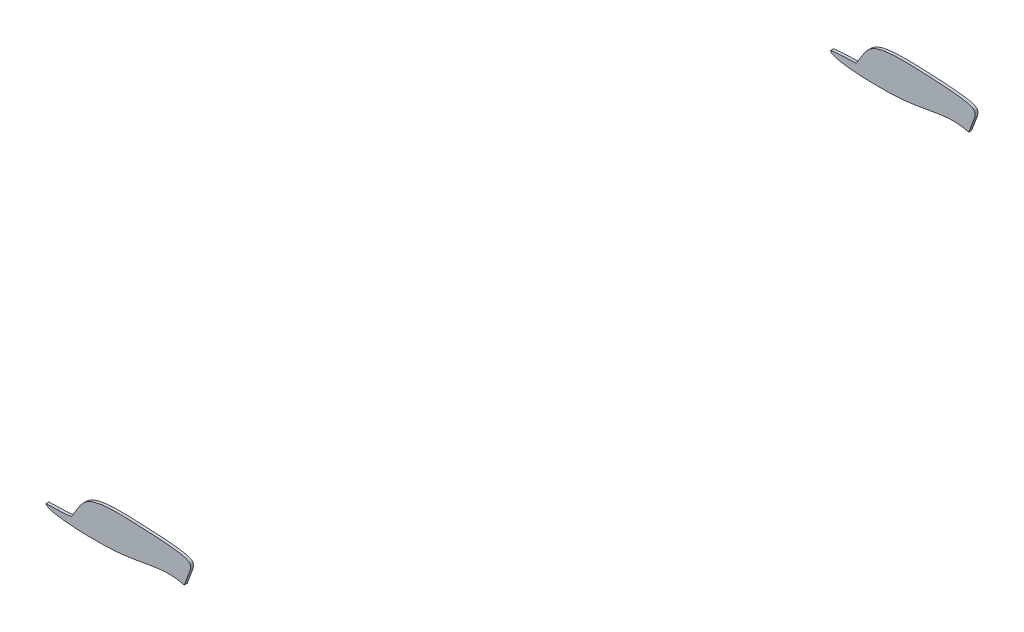
from build123d import *

# Parameters (mm, degrees)
BOSS_EXTRUDE1_START = -100
BOSS_EXTRUDE1_DEPTH = 100
BOSS_EXTRUDE2_DEPTH = 100


# Read off the part's stored shape, not the designer's step: Boss-Extrude1
with BuildPart() as part:
    # Boss-Extrude1 outline → Boss-Extrude1 (new body)
    with BuildSketch(Plane.XY.offset(14000).offset(BOSS_EXTRUDE1_START)):
        with BuildLine():
            add(Edge.make_bspline(
                [(5531.048982521, 503.061584124), (5984.616082643, 1919.72784269), (6610.819234991, 1057.300960896), (1608.535097677, 1775.314775895), (2314.83364403, 1835.642488739), (1522.852619017, 616.42771481)],
                knots=[0, 0, 0, 0, 0, 0, 1, 1, 1, 1, 1, 1], degree=5))
            add(Edge.make_bspline(
                [(1522.852619017, 616.42771481), (1504.861181316, 559.60506265), (607.536000606, 547.11334457)],
                knots=[0, 0, 0, 1, 1, 1], degree=2))
            add(Edge.make_bspline(
                [(607.536000606, 547.11334457), (608.61547062, 544.033573702), (611.045347663, 537.968945908), (615.483416305, 529.231580539), (620.657786063, 520.910020616), (626.516602345, 513.055207557), (633.000410712, 505.709814659), (639.985420636, 498.842386331), (647.372592677, 492.411753686), (655.068858247, 486.356335059), (663.024312246, 480.646271644), (671.208906672, 475.270208171), (679.588971837, 470.205290463), (690.988425826, 463.840742219), (705.593427952, 456.550096934), (720.539245681, 449.992870153), (732.640301911, 445.096298549), (741.775254544, 441.573611419), (750.956775868, 438.174518939), (760.17671752, 434.88117582), (769.43737021, 431.703719723), (781.838637045, 427.627689694), (797.443068213, 422.851224267), (813.182218698, 418.54076935), (825.823314703, 415.28479904), (835.323121286, 412.916701836), (844.83562701, 410.601086405), (854.355012195, 408.31360718), (863.881907073, 406.057615027), (876.597565949, 403.105824911), (892.519723231, 399.535371849), (911.684221454, 395.517562006), (930.893353507, 391.720269357), (950.130009956, 388.065451499), (969.386896788, 384.5189289), (988.67021316, 381.118206113), (1007.984616594, 377.898879135), (1027.323158164, 374.828500894), (1046.674474761, 371.840251494), (1066.032633628, 368.896585524), (1085.400455087, 366.017052029), (1104.779922418, 363.216939998), (1124.17103078, 360.498585293), (1143.572627524, 357.85624672), (1162.98408502, 355.287244255), (1188.879066439, 351.962070539), (1221.27144442, 347.992324644), (1253.694853147, 344.284620877), (1279.650164831, 341.468786558), (1299.123659905, 339.422633415), (1318.604945661, 337.451782033), (1338.096250077, 335.582262763), (1354.34743157, 334.115199067), (1367.350183883, 332.96210047), (1380.35280587, 331.80759849), (1396.603335737, 330.333517883), (1416.101093714, 328.53368124), (1435.606101938, 326.812513824), (1451.870613039, 325.500988711), (1464.88433906, 324.479230733), (1474.644813184, 323.71523721), (1484.404587951, 322.94216255), (1497.415635354, 321.886638389), (1513.678087803, 320.551060561), (1533.198518249, 319.014763984), (1552.730231069, 317.62942423), (1569.010004189, 316.524874861), (1582.033023329, 315.629011975), (1595.054488748, 314.71101956), (1611.330116555, 313.546728481), (1630.863846699, 312.190925146), (1650.40499827, 310.946230156), (1669.952298429, 309.802443077), (1689.505176617, 308.75845179), (1709.061792936, 307.787853934), (1728.61969466, 306.84382394), (1748.176803297, 305.88342049), (1767.732939289, 304.903427735), (1787.287317514, 303.888737969), (1806.841472739, 302.870437445), (1826.399598884, 301.928521883), (1845.963978582, 301.127820717), (1862.269438019, 300.508624137), (1875.313266654, 299.998731234), (1888.356157971, 299.465418782), (1904.65898391, 298.780422978), (1924.224800231, 298.015468656), (1943.795630348, 297.391203709), (1963.368633052, 296.843677412), (1982.941685065, 296.29698828), (2002.513713366, 295.715113461), (2022.084984445, 295.108136884), (2041.655275855, 294.470647575), (2057.964926644, 293.972471311), (2071.014155227, 293.626953252), (2084.064566948, 293.329081014), (2100.37886752, 293.019616664), (2119.956329983, 292.664396289), (2136.269723154, 292.309407413), (2149.320526825, 292.031041011), (2159.108939004, 291.836426272), (2168.897798293, 291.66587555), (2181.950373155, 291.486248718), (2198.26687855, 291.329884927), (2217.8470089, 291.184094373), (2237.426904577, 291.008768802), (2257.006547852, 290.807597963), (2276.585856414, 290.575705883), (2296.165125149, 290.342054673), (2315.745191108, 290.176957564), (2335.325914448, 290.139527376), (2354.906551987, 290.175168405), (2374.487193904, 290.213456844), (2394.067870789, 290.219987369), (2413.648543328, 290.201800561), (2433.229151737, 290.151521946), (2449.546403949, 290.14100305), (2462.600132083, 290.185221882), (2475.653616877, 290.277620966), (2491.969863794, 290.45722968), (2511.549174815, 290.689829761), (2527.865887706, 290.821524602), (2540.919201941, 290.933090428), (2550.709037068, 291.031512036), (2560.498599137, 291.156323148), (2573.550589518, 291.374545737), (2589.864222862, 291.717682451), (2609.440136227, 292.150198439), (2625.754700423, 292.446135862), (2638.806253516, 292.687788485), (2648.594628936, 292.883370561), (2658.38247469, 293.105186511), (2671.431659214, 293.452772205), (2687.741067154, 293.95849614), (2707.311657397, 294.58709778), (2723.622413007, 295.047799609), (2736.67089337, 295.419401425), (2746.45683921, 295.712991861), (2756.242016365, 296.031018149), (2769.287180188, 296.506337268), (2785.590855824, 297.171616757), (2805.154101198, 297.997882877), (2824.71989585, 298.761492393), (2844.285860835, 299.520343852), (2863.848824804, 300.354579472), (2883.406705271, 301.300747799), (2902.959301598, 302.350260883), (2922.50598772, 303.50436754), (2942.049631218, 304.707891129), (2961.595039944, 305.882807452), (2981.142707939, 307.019196803), (3000.687635571, 308.202637868), (3020.225661534, 309.49562388), (3039.756807498, 310.887944222), (3059.28318655, 312.345539503), (3078.804587053, 313.868199369), (3098.318759061, 315.481844866), (3117.822543102, 317.21606208), (3134.071645557, 318.705524121), (3147.07199615, 319.885422701), (3160.074404694, 321.04260139), (3176.329271368, 322.467435071), (3192.580240036, 323.937531583), (3205.573604516, 325.192108736), (3215.315790987, 326.162218516), (3225.056008905, 327.151432155), (3234.796171581, 328.141411302), (3244.53717325, 329.123094256), (3254.280837799, 330.077949946), (3264.026051076, 331.017022606), (3277.01868606, 332.278641834), (3290.006739177, 333.588629717), (3302.980704314, 335.031089145), (3312.704166049, 336.173602569), (3322.423153916, 337.353545598), (3332.139758646, 338.552835581), (3341.856085013, 339.754383361), (3351.575085126, 340.934216659), (3361.29629059, 342.095568876), (3374.259141588, 343.633688227), (3390.461855869, 345.563726591), (3409.892142026, 347.986574856), (3429.308371794, 350.519515043), (3448.711673065, 353.149472407), (3468.104020255, 355.858864302), (3487.491391623, 358.603405658), (3506.880201391, 361.337827864), (3526.271689869, 364.053170713), (3545.66594066, 366.748735182), (3565.061946358, 369.431575423), (3584.453005196, 372.150202899), (3603.832089653, 374.953067351), (3623.197069227, 377.85186739), (3642.547786074, 380.844310475), (3661.884750401, 383.924268366), (3681.214768136, 387.047259046), (3700.54544639, 390.166223553), (3719.879472228, 393.264342472), (3739.217404669, 396.338045035), (3758.559030951, 399.388278798), (3777.894903953, 402.475166967), (3797.212840239, 405.672622357), (3816.513495944, 408.972461893), (3835.8105353, 412.293129166), (3855.113368098, 415.580082439), (3874.419039907, 418.850209506), (3893.72276753, 422.131854963), (3913.024553094, 425.424848038), (3932.329058166, 428.701959751), (3951.639273707, 431.945114623), (3970.946564172, 435.205924744), (3990.236223479, 438.569786422), (4009.506067572, 442.045122111), (4028.769515514, 445.555383558), (4048.038090444, 449.037551001), (4067.31084157, 452.496431034), (4086.583118015, 455.957985356), (4105.853563621, 459.429703243), (4125.124135337, 462.900725798), (4144.396546268, 466.361525475), (4163.669061185, 469.821735181), (4182.937037345, 473.307201343), (4202.200648755, 476.816573218), (4221.471979804, 480.283718859), (4240.763637768, 483.636065575), (4260.071165826, 486.89539909), (4279.382068958, 490.134492439), (4298.688394259, 493.400851865), (4317.990754787, 496.690516203), (4337.28744469, 500.013331686), (4356.585145913, 503.330151005), (4375.896824796, 506.565347931), (4392.008118513, 509.149974112), (4404.900764264, 511.194689047), (4414.570463138, 512.726854296), (4424.238785744, 514.267770646), (4437.125976763, 516.346684825), (4453.232618521, 518.959611483), (4472.571337391, 522.029057108), (4488.706933543, 524.45768327), (4501.619210743, 526.374349669), (4511.303593412, 527.810894971), (4520.986221455, 529.259193778), (4530.665132197, 530.732064072), (4540.342696137, 532.213947184), (4553.247801306, 534.178158675), (4569.388680039, 536.572297733), (4588.791673589, 539.206739788), (4608.216570692, 541.672220563), (4627.651072185, 544.060556001), (4647.08965418, 546.415232284), (4666.534777645, 548.715536053), (4685.986630841, 550.95811914), (4705.449903688, 553.100220376), (4724.929497464, 555.089082876), (4744.426489939, 556.899743534), (4763.937702714, 558.549243866), (4783.461264209, 560.045925015), (4802.995641445, 561.393402704), (4822.539449616, 562.597067692), (4842.091968729, 563.649302095), (4861.653313282, 564.52565218), (4877.96116867, 565.083894609), (4891.009381962, 565.464953459), (4900.796064481, 565.732798346), (4910.583012007, 565.990695672), (4920.369768813, 566.255027034), (4930.156724045, 566.513695181), (4943.206863096, 566.819984384), (4956.259260201, 567.034127934), (4969.313176804, 567.069570609), (4982.366854311, 566.997249821), (4995.419449506, 566.813605057), (5008.471450776, 566.59900517), (5018.260612954, 566.447548259), (5028.049860984, 566.299275075), (5041.101660378, 566.075370308), (5057.415225205, 565.713528341), (5076.982990205, 564.986852625), (5096.537965538, 563.97421434), (5116.077307041, 562.696390887), (5135.599894905, 561.185558875), (5155.108745109, 559.508841539), (5174.608770126, 557.732881317), (5194.094681986, 555.805775495), (5213.553787347, 553.622500157), (5232.97889468, 551.155583017), (5249.145925444, 548.946400038), (5262.072784413, 547.130316334), (5274.994236221, 545.276167348), (5291.134231174, 542.876657958), (5310.468899127, 539.779891921), (5329.760330162, 536.424183936), (5349.00943791, 532.834376939), (5368.216987628, 529.028350803), (5387.381953507, 525.013752105), (5406.503371483, 520.796327248), (5425.578403808, 516.374125192), (5444.600320964, 511.727830682), (5463.556254711, 506.819502092), (5482.456038185, 501.700073378), (5495.038452347, 498.223888954), (5502.808108312, 496.101903683), (5505.042161697, 495.588559563), (5508.050425487, 495.053082009), (5510.319901329, 494.734958781), (5512.600732174, 494.510454518), (5514.88970225, 494.392835838), (5517.181995748, 494.398670181), (5519.469647037, 494.549933658), (5521.739822064, 494.875759331), (5523.969653163, 495.416692588), (5526.11864835, 496.228350018), (5528.107197445, 497.387805041), (5529.783926539, 498.980781412), (5530.837416525, 500.952015061), (5531.04616279, 502.389725173), (5531.048982521, 503.061584124)],
                knots=[0, 0, 0, 0, 0.000969471, 0.001938943, 0.002908414, 0.003877885, 0.004847357, 0.005816828, 0.006786299, 0.007755771, 0.008725242, 0.009694713, 0.010664184, 0.011633656, 0.013572598, 0.015511541, 0.016481012, 0.017450484, 0.018419955, 0.019389426, 0.020358898, 0.021328369, 0.023267312, 0.025206254, 0.026175725, 0.027145197, 0.028114668, 0.029084139, 0.030053611, 0.031023082, 0.032962025, 0.034900967, 0.03683991, 0.038778853, 0.040717795, 0.042656738, 0.04459568, 0.046534623, 0.048473566, 0.050412508, 0.052351451, 0.054290394, 0.056229336, 0.058168279, 0.060107221, 0.062046164, 0.065924049, 0.069801935, 0.071740877, 0.07367982, 0.075618763, 0.077557705, 0.079496648, 0.080466119, 0.08143559, 0.083374533, 0.085313476, 0.087252418, 0.089191361, 0.090160832, 0.091130304, 0.092099775, 0.093069246, 0.095008189, 0.096947131, 0.098886074, 0.100825017, 0.101794488, 0.102763959, 0.104702902, 0.106641845, 0.108580787, 0.11051973, 0.112458672, 0.114397615, 0.116336558, 0.1182755, 0.120214443, 0.122153386, 0.124092328, 0.126031271, 0.127970213, 0.129909156, 0.130878627, 0.131848099, 0.133787041, 0.135725984, 0.137664927, 0.139603869, 0.141542812, 0.143481754, 0.145420697, 0.14735964, 0.149298582, 0.150268054, 0.151237525, 0.153176468, 0.15511541, 0.157054353, 0.158023824, 0.158993296, 0.159962767, 0.160932238, 0.162871181, 0.164810123, 0.166749066, 0.168688009, 0.170626951, 0.172565894, 0.174504837, 0.176443779, 0.178382722, 0.180321664, 0.182260607, 0.18419955, 0.186138492, 0.188077435, 0.189046906, 0.190016378, 0.19195532, 0.193894263, 0.195833205, 0.196802677, 0.197772148, 0.198741619, 0.199711091, 0.201650033, 0.203588976, 0.205527919, 0.20649739, 0.207466861, 0.208436333, 0.209405804, 0.211344746, 0.213283689, 0.215222632, 0.216192103, 0.217161574, 0.218131046, 0.219100517, 0.22103946, 0.222978402, 0.224917345, 0.226856288, 0.22879523, 0.230734173, 0.232673115, 0.234612058, 0.236551001, 0.238489943, 0.240428886, 0.242367829, 0.244306771, 0.246245714, 0.248184656, 0.250123599, 0.252062542, 0.254001484, 0.255940427, 0.256909898, 0.25787937, 0.259818312, 0.261757255, 0.262726726, 0.263696197, 0.264665669, 0.26563514, 0.266604611, 0.267574083, 0.268543554, 0.269513025, 0.271451968, 0.272421439, 0.273390911, 0.274360382, 0.275329853, 0.276299325, 0.277268796, 0.278238267, 0.279207738, 0.281146681, 0.283085624, 0.285024566, 0.286963509, 0.288902452, 0.290841394, 0.292780337, 0.294719279, 0.296658222, 0.298597165, 0.300536107, 0.30247505, 0.304413993, 0.306352935, 0.308291878, 0.310230821, 0.312169763, 0.314108706, 0.316047648, 0.317986591, 0.319925534, 0.321864476, 0.323803419, 0.325742362, 0.327681304, 0.329620247, 0.331559189, 0.333498132, 0.335437075, 0.337376017, 0.33931496, 0.341253903, 0.343192845, 0.345131788, 0.34707073, 0.349009673, 0.350948616, 0.352887558, 0.354826501, 0.356765444, 0.358704386, 0.360643329, 0.362582271, 0.364521214, 0.366460157, 0.368399099, 0.370338042, 0.372276985, 0.374215927, 0.37615487, 0.378093813, 0.380032755, 0.381971698, 0.382941169, 0.38391064, 0.384880112, 0.385849583, 0.387788526, 0.389727468, 0.391666411, 0.392635882, 0.393605354, 0.394574825, 0.395544296, 0.396513767, 0.397483239, 0.399422181, 0.401361124, 0.403300067, 0.405239009, 0.407177952, 0.409116895, 0.411055837, 0.41299478, 0.414933722, 0.416872665, 0.418811608, 0.42075055, 0.422689493, 0.424628436, 0.426567378, 0.428506321, 0.430445263, 0.431414735, 0.432384206, 0.433353677, 0.434323149, 0.43529262, 0.436262091, 0.438201034, 0.439170505, 0.440139977, 0.442078919, 0.443048391, 0.444017862, 0.444987333, 0.445956804, 0.447895747, 0.44983469, 0.451773632, 0.453712575, 0.455651518, 0.45759046, 0.459529403, 0.461468346, 0.463407288, 0.465346231, 0.467285173, 0.468254645, 0.469224116, 0.471163059, 0.473102001, 0.475040944, 0.476979887, 0.478918829, 0.480857772, 0.482796714, 0.484735657, 0.4866746, 0.488613542, 0.490552485, 0.492491428, 0.492491428, 0.492945263, 0.493172181, 0.493399099, 0.493626017, 0.493852935, 0.494079853, 0.494306771, 0.494533689, 0.494760607, 0.494987525, 0.495214443, 0.495441361, 0.495668279, 0.495867755, 0.495867755, 0.495867755, 0.495867755], degree=3))
        make_face()
    extrude(amount=BOSS_EXTRUDE1_DEPTH)


with BuildPart() as body_2:
    # Sketch9 → Boss-Extrude2 (new body)
    with BuildSketch(Plane.XY.offset(-14000)):
        with BuildLine():
            add(Edge.make_bspline(
                [(5531.048982521, 503.06158413), (5531.04616279, 502.389725175), (5530.837416525, 500.952015062), (5529.783926539, 498.980781412), (5528.107197445, 497.387805041), (5526.11864835, 496.228350018), (5523.969653163, 495.416692588), (5521.739822064, 494.875759331), (5519.469647037, 494.549933658), (5517.181995748, 494.398670181), (5514.88970225, 494.392835838), (5512.600732174, 494.510454518), (5510.319901329, 494.734958781), (5508.050425487, 495.053082009), (5505.042161697, 495.588559563), (5502.808108312, 496.101903683), (5495.038452347, 498.223888954), (5482.456038185, 501.700073378), (5463.556254711, 506.819502092), (5444.600320963, 511.727830682), (5425.578403808, 516.374125192), (5406.503371483, 520.796327248), (5387.381953507, 525.013752105), (5368.216987628, 529.028350803), (5349.00943791, 532.834376939), (5329.760330162, 536.424183936), (5310.468899127, 539.779891921), (5291.134231174, 542.876657958), (5271.76623723, 545.756069226), (5252.379331596, 548.504563442), (5232.97889468, 551.155583017), (5213.553787347, 553.622500157), (5194.094681986, 555.805775495), (5174.608770126, 557.732881317), (5155.108745109, 559.508841539), (5135.599894905, 561.185558875), (5116.077307041, 562.696390887), (5096.537965538, 563.97421434), (5076.982990205, 564.986852625), (5057.415225205, 565.713528341), (5041.101660378, 566.075370308), (5028.049860984, 566.299275075), (5018.260612954, 566.447548259), (5008.471450776, 566.59900517), (4995.419449506, 566.813605057), (4982.366854311, 566.997249821), (4969.313176804, 567.069570609), (4956.259260201, 567.034127934), (4943.206863096, 566.819984384), (4930.156724045, 566.513695181), (4920.369768813, 566.255027034), (4910.583012007, 565.990695672), (4900.796064481, 565.732798346), (4891.009381962, 565.464953459), (4877.96116867, 565.083894609), (4861.653313282, 564.52565218), (4842.091968729, 563.649302095), (4822.539449616, 562.597067692), (4802.995641445, 561.393402704), (4783.461264209, 560.045925015), (4763.937702714, 558.549243866), (4744.426489939, 556.899743534), (4724.929497464, 555.089082876), (4705.449903688, 553.100220376), (4685.986630841, 550.95811914), (4666.534777645, 548.715536053), (4647.08965418, 546.415232284), (4627.651072185, 544.060556001), (4608.216570692, 541.672220563), (4588.791673589, 539.206739788), (4569.388680039, 536.572297733), (4553.247801306, 534.178158675), (4540.342696137, 532.213947184), (4530.665132197, 530.732064072), (4520.986221455, 529.259193778), (4511.303593412, 527.810894971), (4501.619210743, 526.374349669), (4488.706933543, 524.45768327), (4472.571337391, 522.029057108), (4453.232618521, 518.959611483), (4437.125976763, 516.346684825), (4424.238785744, 514.267770646), (4411.347688936, 512.213215512), (4395.230377256, 509.666899349), (4375.896824796, 506.565347931), (4356.585145913, 503.330151005), (4337.28744469, 500.013331686), (4317.990754787, 496.690516203), (4298.688394259, 493.400851865), (4279.382068958, 490.134492439), (4260.071165826, 486.89539909), (4240.763637768, 483.636065575), (4221.471979804, 480.283718859), (4202.200648755, 476.816573218), (4182.937037345, 473.307201343), (4163.669061185, 469.821735181), (4144.396546268, 466.361525475), (4125.124135337, 462.900725798), (4105.853563621, 459.429703243), (4086.583118015, 455.957985356), (4067.31084157, 452.496431034), (4048.038090444, 449.037551001), (4028.769515514, 445.555383558), (4009.506067572, 442.045122111), (3990.236223479, 438.569786422), (3970.946564172, 435.205924744), (3951.639273707, 431.945114623), (3932.329058166, 428.701959751), (3913.024553094, 425.424848038), (3893.72276753, 422.131854963), (3874.419039907, 418.850209506), (3855.113368098, 415.580082439), (3835.8105353, 412.293129166), (3816.513495944, 408.972461893), (3797.212840239, 405.672622357), (3777.894903953, 402.475166967), (3758.559030951, 399.388278798), (3739.217404669, 396.338045035), (3719.879472228, 393.264342472), (3700.54544639, 390.166223553), (3681.214768136, 387.047259046), (3661.884750401, 383.924268366), (3642.547786074, 380.844310475), (3623.197069227, 377.85186739), (3603.832089653, 374.953067351), (3584.453005196, 372.150202899), (3565.061946358, 369.431575423), (3545.66594066, 366.748735182), (3526.271689869, 364.053170713), (3506.880201391, 361.337827864), (3487.491391623, 358.603405658), (3468.104020255, 355.858864302), (3448.711673065, 353.149472407), (3429.308371794, 350.519515043), (3409.892142026, 347.986574856), (3390.461855869, 345.563726591), (3371.018598731, 343.247680554), (3354.81475183, 341.327494424), (3341.856085013, 339.754383361), (3332.139758646, 338.552835581), (3322.423153916, 337.353545598), (3312.704166049, 336.173602569), (3302.980704314, 335.031089145), (3290.006739177, 333.588629717), (3277.01868606, 332.278641834), (3264.026051076, 331.017022606), (3254.280837799, 330.077949946), (3244.53717325, 329.123094256), (3234.796171581, 328.141411302), (3225.056008905, 327.151432155), (3212.069051681, 325.832480637), (3195.83043377, 324.231550885), (3176.329271368, 322.467435071), (3160.074404694, 321.04260139), (3147.07199615, 319.885422702), (3134.071645557, 318.705524121), (3117.822543102, 317.21606208), (3098.318759061, 315.481844866), (3078.804587053, 313.868199369), (3059.28318655, 312.345539503), (3039.756807498, 310.887944222), (3020.225661534, 309.49562388), (3000.687635571, 308.202637868), (2981.142707939, 307.019196803), (2961.595039944, 305.882807452), (2942.049631218, 304.707891129), (2922.50598772, 303.50436754), (2902.959301598, 302.350260883), (2883.406705271, 301.300747799), (2863.848824804, 300.354579472), (2844.285860835, 299.520343852), (2824.71989585, 298.761492393), (2805.154101198, 297.997882877), (2785.590855824, 297.171616757), (2769.287180188, 296.506337268), (2756.242016365, 296.031018149), (2746.45683921, 295.712991861), (2736.67089337, 295.419401425), (2723.622413007, 295.047799609), (2707.311657397, 294.58709778), (2687.741067154, 293.95849614), (2671.431659214, 293.452772205), (2658.38247469, 293.105186511), (2645.332013685, 292.809431912), (2629.017613262, 292.505323346), (2609.440136227, 292.150198439), (2589.864222862, 291.717682451), (2573.550589518, 291.374545737), (2560.498599137, 291.156323148), (2547.445849712, 290.989908332), (2531.129230284, 290.84786357), (2511.549174815, 290.689829761), (2491.969863794, 290.45722968), (2475.653616877, 290.277620966), (2462.600132084, 290.185221882), (2449.546403949, 290.14100305), (2433.229151737, 290.151521946), (2413.648543328, 290.201800561), (2394.067870789, 290.219987369), (2374.487193904, 290.213456844), (2354.906551987, 290.175168405), (2335.325914448, 290.139527376), (2315.745191108, 290.176957564), (2296.165125149, 290.342054673), (2276.585856414, 290.575705883), (2257.006547852, 290.807597963), (2237.426904577, 291.008768802), (2217.8470089, 291.184094373), (2198.26687855, 291.329884927), (2181.950373155, 291.486248718), (2168.897798293, 291.66587555), (2159.108939004, 291.836426272), (2149.320526825, 292.031041011), (2136.269723154, 292.309407413), (2119.956329983, 292.664396289), (2100.37886752, 293.019616664), (2084.064566948, 293.329081014), (2071.014155227, 293.626953252), (2057.964926644, 293.972471311), (2041.655275855, 294.470647575), (2022.084984445, 295.108136884), (2002.513713366, 295.715113461), (1982.941685065, 296.29698828), (1963.368633052, 296.843677412), (1943.795630348, 297.391203709), (1924.224800231, 298.015468656), (1904.65898391, 298.780422978), (1888.356157971, 299.465418782), (1875.313266654, 299.998731234), (1862.269438019, 300.508624137), (1845.963978582, 301.127820717), (1826.399598884, 301.928521883), (1806.841472739, 302.870437445), (1787.287317514, 303.888737969), (1767.732939289, 304.903427735), (1748.176803297, 305.88342049), (1728.61969466, 306.84382394), (1709.061792936, 307.787853934), (1689.505176617, 308.75845179), (1669.952298429, 309.802443077), (1650.40499827, 310.946230156), (1630.863846699, 312.190925146), (1611.330116555, 313.546728481), (1595.054488748, 314.71101956), (1582.033023329, 315.629011975), (1569.010004189, 316.524874861), (1552.730231069, 317.62942423), (1533.198518249, 319.014763984), (1513.678087803, 320.551060561), (1497.415635354, 321.886638389), (1484.404587951, 322.94216255), (1471.391554928, 323.972928763), (1455.123515259, 325.238683688), (1435.606101938, 326.812513824), (1416.101093714, 328.53368124), (1396.603335737, 330.333517883), (1377.102699897, 332.102414612), (1357.597667869, 333.821786328), (1338.096250077, 335.582262763), (1318.604945661, 337.451782033), (1299.123659905, 339.422633415), (1279.650164831, 341.468786558), (1253.694853147, 344.284620877), (1221.27144442, 347.992324644), (1188.879066439, 351.962070539), (1162.98408502, 355.287244255), (1143.572627524, 357.85624672), (1124.17103078, 360.498585293), (1104.779922418, 363.216939998), (1085.400455087, 366.017052029), (1066.032633628, 368.896585524), (1046.674474761, 371.840251494), (1027.323158164, 374.828500894), (1007.984616594, 377.898879135), (988.67021316, 381.118206113), (969.386896788, 384.5189289), (950.130009956, 388.065451499), (930.893353507, 391.720269357), (911.684221454, 395.517562006), (892.519723231, 399.535371849), (876.597565949, 403.105824911), (863.881907073, 406.057615027), (854.355012195, 408.31360718), (844.83562701, 410.601086405), (835.323121286, 412.916701836), (825.823314703, 415.28479904), (813.182218698, 418.54076935), (797.443068213, 422.851224267), (781.838637045, 427.627689694), (769.43737021, 431.703719723), (760.17671752, 434.88117582), (750.956775868, 438.174518939), (741.775254544, 441.573611419), (732.640301911, 445.096298549), (720.539245681, 449.992870153), (705.593427952, 456.550096934), (690.988425826, 463.840742219), (679.588971837, 470.205290463), (671.208906672, 475.270208171), (663.024312246, 480.646271644), (655.068858247, 486.356335059), (647.372592677, 492.411753686), (639.985420636, 498.842386331), (633.000410712, 505.709814659), (626.516602345, 513.055207557), (620.657786063, 520.910020616), (615.483416305, 529.231580539), (611.045347663, 537.968945908), (608.61547062, 544.033573702), (607.536000606, 547.11334457)],
                knots=[0.003885047, 0.003885047, 0.003885047, 0.003885047, 0.004084523, 0.004311441, 0.004538359, 0.004765277, 0.004992195, 0.005219113, 0.005446031, 0.005672949, 0.005899867, 0.006126785, 0.006353703, 0.00658062, 0.006807538, 0.007261374, 0.007261374, 0.009200317, 0.01113926, 0.013078202, 0.015017145, 0.016956087, 0.01889503, 0.020833973, 0.022772915, 0.024711858, 0.026650801, 0.028589743, 0.030528686, 0.032467628, 0.034406571, 0.036345514, 0.038284456, 0.040223399, 0.042162342, 0.044101284, 0.046040227, 0.04797917, 0.049918112, 0.051857055, 0.053795997, 0.054765469, 0.05573494, 0.056704411, 0.057673883, 0.059612825, 0.060582297, 0.061551768, 0.063490711, 0.064460182, 0.065429653, 0.066399124, 0.067368596, 0.068338067, 0.069307538, 0.071246481, 0.073185424, 0.075124366, 0.077063309, 0.079002252, 0.080941194, 0.082880137, 0.084819079, 0.086758022, 0.088696965, 0.090635907, 0.09257485, 0.094513793, 0.096452735, 0.098391678, 0.10033062, 0.102269563, 0.103239034, 0.104208506, 0.105177977, 0.106147448, 0.10711692, 0.108086391, 0.110025334, 0.111964276, 0.113903219, 0.11487269, 0.115842162, 0.117781104, 0.119720047, 0.121658989, 0.123597932, 0.125536875, 0.127475817, 0.12941476, 0.131353703, 0.133292645, 0.135231588, 0.13717053, 0.139109473, 0.141048416, 0.142987358, 0.144926301, 0.146865244, 0.148804186, 0.150743129, 0.152682071, 0.154621014, 0.156559957, 0.158498899, 0.160437842, 0.162376785, 0.164315727, 0.16625467, 0.168193612, 0.170132555, 0.172071498, 0.17401044, 0.175949383, 0.177888326, 0.179827268, 0.181766211, 0.183705154, 0.185644096, 0.187583039, 0.189521981, 0.191460924, 0.193399867, 0.195338809, 0.197277752, 0.199216695, 0.201155637, 0.20309458, 0.205033522, 0.206972465, 0.208911408, 0.21085035, 0.212789293, 0.214728236, 0.216667178, 0.218606121, 0.220545063, 0.222484006, 0.223453477, 0.224422949, 0.22539242, 0.226361891, 0.227331363, 0.228300834, 0.230239777, 0.231209248, 0.232178719, 0.233148191, 0.234117662, 0.235087133, 0.236056604, 0.237995547, 0.23993449, 0.241873432, 0.242842904, 0.243812375, 0.245751318, 0.24769026, 0.249629203, 0.251568145, 0.253507088, 0.255446031, 0.257384973, 0.259323916, 0.261262859, 0.263201801, 0.265140744, 0.267079687, 0.269018629, 0.270957572, 0.272896514, 0.274835457, 0.2767744, 0.278713342, 0.280652285, 0.281621756, 0.282591228, 0.283560699, 0.28453017, 0.286469113, 0.288408055, 0.290346998, 0.291316469, 0.292285941, 0.294224883, 0.296163826, 0.298102769, 0.300041711, 0.301011183, 0.301980654, 0.303919596, 0.305858539, 0.307797482, 0.309736424, 0.310705896, 0.311675367, 0.31361431, 0.315553252, 0.317492195, 0.319431137, 0.32137008, 0.323309023, 0.325247965, 0.327186908, 0.329125851, 0.331064793, 0.333003736, 0.334942679, 0.336881621, 0.338820564, 0.339790035, 0.340759506, 0.341728978, 0.342698449, 0.344637392, 0.346576334, 0.348515277, 0.349484748, 0.35045422, 0.352393162, 0.354332105, 0.356271047, 0.35820999, 0.360148933, 0.362087875, 0.364026818, 0.365965761, 0.367904703, 0.368874175, 0.369843646, 0.371782588, 0.373721531, 0.375660474, 0.377599416, 0.379538359, 0.381477302, 0.383416244, 0.385355187, 0.387294129, 0.389233072, 0.391172015, 0.393110957, 0.3950499, 0.396988843, 0.397958314, 0.398927785, 0.400866728, 0.40280567, 0.404744613, 0.406683556, 0.407653027, 0.408622498, 0.410561441, 0.412500384, 0.414439326, 0.416378269, 0.418317212, 0.420256154, 0.422195097, 0.424134039, 0.426072982, 0.428011925, 0.429950867, 0.433828753, 0.437706638, 0.43964558, 0.441584523, 0.443523466, 0.445462408, 0.447401351, 0.449340294, 0.451279236, 0.453218179, 0.455157121, 0.457096064, 0.459035007, 0.460973949, 0.462912892, 0.464851835, 0.466790777, 0.46872972, 0.469699191, 0.470668662, 0.471638134, 0.472607605, 0.473577076, 0.474546548, 0.47648549, 0.478424433, 0.479393904, 0.480363376, 0.481332847, 0.482302318, 0.48327179, 0.484241261, 0.486180204, 0.488119146, 0.489088617, 0.490058089, 0.49102756, 0.491997031, 0.492966503, 0.493935974, 0.494905445, 0.495874917, 0.496844388, 0.497813859, 0.498783331, 0.499752802, 0.499752802, 0.499752802, 0.499752802], degree=3))
            add(Edge.make_bspline(
                [(1522.852619017, 616.42771481), (1522.685060868, 616.054542136), (601.474051548, 593.434788915), (607.536000606, 547.11334457)],
                knots=[0, 0, 0, 0, 1, 1, 1, 1], degree=3))
            add(Edge.make_bspline(
                [(5531.048982521, 503.06158413), (5984.616082643, 1919.72784269), (6610.819234991, 1057.300960896), (1608.535097677, 1775.314775895), (2314.83364403, 1835.642488739), (1522.852619017, 616.42771481)],
                knots=[0, 0, 0, 0, 0, 0, 1, 1, 1, 1, 1, 1], degree=5))
        make_face()
    extrude(amount=BOSS_EXTRUDE2_DEPTH)


solid = Compound([part.part, body_2.part])
